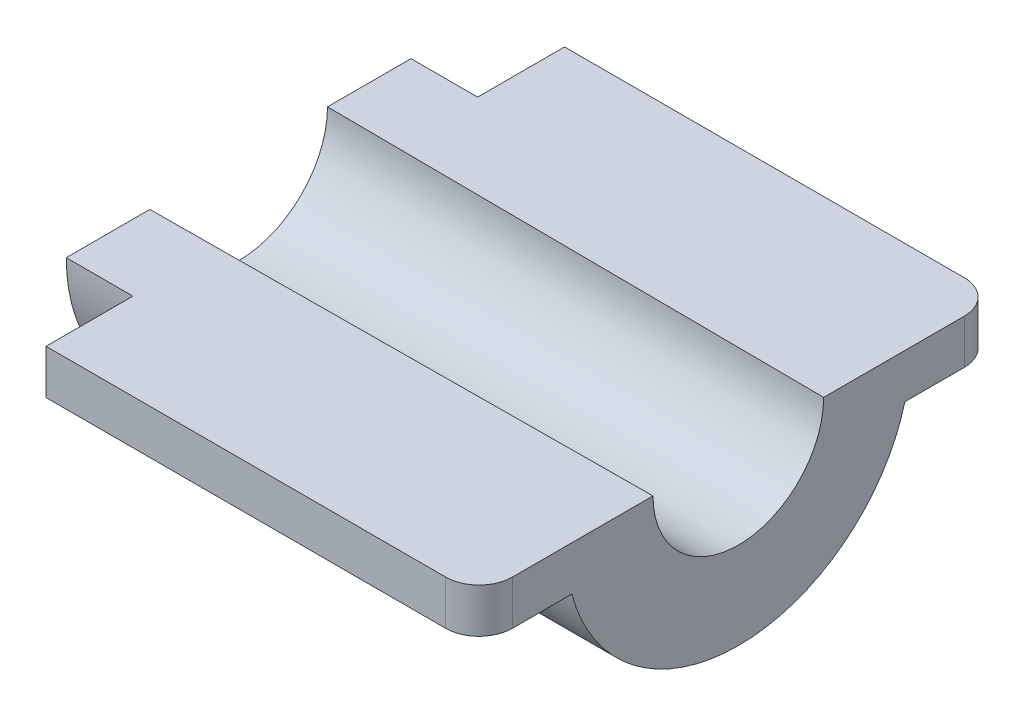
from build123d import *

# Parameters (mm, degrees)
BOSS_EXTRUDE1_DEPTH = 35
BOSS_EXTRUDE2_START = 10
BOSS_EXTRUDE2_DEPTH = 10
FILLET1_R           = 3
FILLET3_R           = 3
BOSS_EXTRUDE3_START = 4
BOSS_EXTRUDE3_DEPTH = 4
SKETCH4_R           = 8
CUT_EXTRUDE7_DEPTH  = 54.020962835
CUT_EXTRUDE7_DRAFT  = -0.4


with BuildPart() as part:
    # Sketch1 → Boss-Extrude1 (new body)
    with BuildSketch(Plane(origin=(0, 0, 0), x_dir=(0, 0, -1), z_dir=(1, 0, 0))):
        with BuildLine():
            Line((-9, 0), (-16.35, 0))
            Line((-16.35, 0), (-23.35, 0))
            Line((-23.35, 0), (-23.35, -4))
            Line((-23.35, -4), (-15, -4))
            ThreePointArc((-15, -4), (0, -15.524174696), (15, -4))
            Line((15, -4), (23.35, -4))
            Line((23.35, -4), (23.35, 0))
            Line((23.35, 0), (16.35, 0))
            Line((16.35, 0), (9, 0))
            Line((9, 0), (-9, 0))
        make_face()
    extrude(amount=BOSS_EXTRUDE1_DEPTH)

    # Sketch2 → Boss-Extrude2 (add)
    with BuildSketch(Plane.ZY.offset(BOSS_EXTRUDE2_START)):
        with BuildLine():
            Line((0, 0), (-15.524174696, 0))
            ThreePointArc((-15.524174696, 0), (-15.392573216, -2.017099348), (-15, -4))
            ThreePointArc((-15, -4), (0, -15.524174696), (15, -4))
            ThreePointArc((15, -4), (15.392573216, -2.017099348), (15.524174696, 0))
            Line((15.524174696, 0), (0, 0))
        make_face()
    extrude(amount=-BOSS_EXTRUDE2_DEPTH)

    # Fillet1
    fillet1_edges = [part.edges().sort_by_distance(p)[0] for p in [
        (35, -2, 23.35),
    ]]
    fillet(fillet1_edges, radius=FILLET1_R)

    # Fillet3
    fillet3_edges = [part.edges().sort_by_distance(p)[0] for p in [
        (35, -2, -23.35),
    ]]
    fillet(fillet3_edges, radius=FILLET3_R)

    # Sketch3 → Boss-Extrude3 (add)
    with BuildSketch(Plane.ZY.offset(BOSS_EXTRUDE3_START)):
        with BuildLine():
            Line((-15.524174696, 0), (-23.35, 0))
            Line((-23.35, 0), (-23.35, -4))
            Line((-23.35, -4), (-15, -4))
            ThreePointArc((-15, -4), (-15.392573216, -2.017099348), (-15.524174696, 0))
        make_face()
        with BuildLine():
            Line((23.35, -4), (15, -4))
            ThreePointArc((15, -4), (15.392573216, -2.017099348), (15.524174696, 0))
            Line((15.524174696, 0), (23.35, 0))
            Line((23.35, 0), (23.35, -4))
        make_face()
    extrude(amount=-BOSS_EXTRUDE3_DEPTH)


with BuildPart() as cut_extrude7_tool:
    # Sketch4 → Cut-Extrude7 (with draft: the straight prism first)
    with BuildSketch(Plane.ZY.offset(10)):
        Circle(SKETCH4_R)
    extrude(amount=-CUT_EXTRUDE7_DEPTH)
    # Cut-Extrude7: the draft: its side faces are tilted about the plane it starts from
    cut_extrude7_sides = [cut_extrude7_tool.faces().sort_by_distance(p)[0] for p in [
        (17.010481418, 0, -8),
    ]]
    draft(cut_extrude7_sides, Plane.ZY.offset(10), CUT_EXTRUDE7_DRAFT)


with BuildPart() as part_1:
    add(part.part)

    # Cut-Extrude7: cut by cut_extrude7_tool
    add(cut_extrude7_tool.part, mode=Mode.SUBTRACT)


solid = part_1.part
